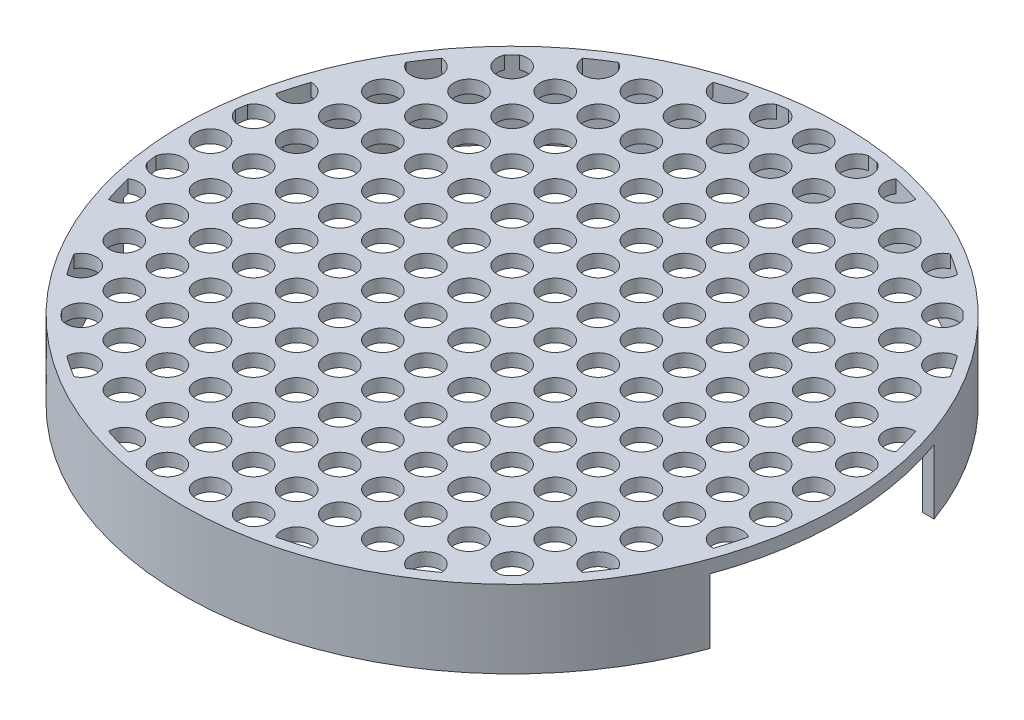
from build123d import *

# Parameters (mm, degrees)
BOSS_EXTRUDE1_DEPTH       = 15
BOSS_EXTRUDE1_2_DEPTH     = 15
BOSS_EXTRUDE2_OUTLINE_R   = 76.5
BOSS_EXTRUDE2_OUTLINE_R_2 = 3.5
BOSS_EXTRUDE2_DEPTH       = 3


with BuildPart() as part:
    # Sketch1 → Boss-Extrude1 (new body)
    with BuildSketch(Plane(origin=(0, 0, 0), x_dir=(1, 0, 0), z_dir=(0, 1, 0))):
        with BuildLine():
            Line((69.282032303, -26), (71.946160426, -26))
            ThreePointArc((71.946160426, -26), (-3.919919174, -76.399504145), (-74.22937424, -18.5))
            Line((-74.22937424, -18.5), (-71.650191905, -18.5))
            ThreePointArc((-71.650191905, -18.5), (-3.932498566, -73.895435955), (69.282032303, -26))
        make_face()
    extrude(amount=BOSS_EXTRUDE1_DEPTH)



with BuildPart() as body_2:
    # Sketch1 → Boss-Extrude1 2 (new body)
    with BuildSketch(Plane(origin=(0, 0, 0), x_dir=(1, 0, 0), z_dir=(0, 1, 0))):
        with BuildLine():
            Line((69.282032303, 26), (71.946160426, 26))
            ThreePointArc((71.946160426, 26), (-3.919919174, 76.399504145), (-74.22937424, 18.5))
            Line((-74.22937424, 18.5), (-71.650191905, 18.5))
            ThreePointArc((-71.650191905, 18.5), (-3.932498566, 73.895435955), (69.282032303, 26))
        make_face()
    extrude(amount=BOSS_EXTRUDE1_2_DEPTH)


with BuildPart() as part_1:
    add(part.part)

    add(body_2.part)  # Boss-Extrude2 merges body 2
    # Boss-Extrude2: read off the stored shape, not the designer's step
    # Boss-Extrude2 outline → Boss-Extrude2 (add)
    with BuildSketch(Plane(origin=(0, 15, 0), x_dir=(1, 0, 0), z_dir=(0, 1, 0))):
        Circle(BOSS_EXTRUDE2_OUTLINE_R)
        with BuildLine():
            ThreePointArc((-43.497444891, -59.866286739), (-38.058549313, -57.08782397), (-38.531401263, -63.176982491))
            ThreePointArc((-38.531401263, -63.176982491), (-41.047814521, -61.571721781), (-43.497444891, -59.866286739))
        make_face(mode=Mode.SUBTRACT)
        with BuildLine():
            ThreePointArc((-63.176982491, -38.531401263), (-57.08782397, -38.058549313), (-59.866286739, -43.497444891))
            ThreePointArc((-59.866286739, -43.497444891), (-61.571721781, -41.047814521), (-63.176982491, -38.531401263))
        make_face(mode=Mode.SUBTRACT)
        with BuildLine():
            ThreePointArc((-53.183850247, -51.453649753), (-47.525126266, -47.525126266), (-51.453649753, -53.183850247))
            ThreePointArc((-51.453649753, -53.183850247), (-52.325901808, -52.325901808), (-53.183850247, -51.453649753))
        make_face(mode=Mode.SUBTRACT)
        with Locations((-40, -50)):
            Circle(BOSS_EXTRUDE2_OUTLINE_R_2, mode=Mode.SUBTRACT)
        with Locations((-50, -40)):
            Circle(BOSS_EXTRUDE2_OUTLINE_R_2, mode=Mode.SUBTRACT)
        with Locations((-40, -40)):
            Circle(BOSS_EXTRUDE2_OUTLINE_R_2, mode=Mode.SUBTRACT)
        with BuildLine():
            ThreePointArc((-23.495828297, -70.170834772), (-19.038476052, -66.634666183), (-17.122096232, -71.991901077))
            ThreePointArc((-17.122096232, -71.991901077), (-20.329363465, -71.152772126), (-23.495828297, -70.170834772))
        make_face(mode=Mode.SUBTRACT)
        with Locations((-30, -60)):
            Circle(BOSS_EXTRUDE2_OUTLINE_R_2, mode=Mode.SUBTRACT)
        with Locations((-20, -60)):
            Circle(BOSS_EXTRUDE2_OUTLINE_R_2, mode=Mode.SUBTRACT)
        with BuildLine():
            ThreePointArc((-11.674890346, -73.073229951), (-9.505025255, -66.535176772), (-9.252609654, -73.419270049))
            ThreePointArc((-9.252609654, -73.419270049), (-10.465180362, -73.256262531), (-11.674890346, -73.073229951))
        make_face(mode=Mode.SUBTRACT)
        with Locations((-10, -60)):
            Circle(BOSS_EXTRUDE2_OUTLINE_R_2, mode=Mode.SUBTRACT)
        with Locations((-30, -50)):
            Circle(BOSS_EXTRUDE2_OUTLINE_R_2, mode=Mode.SUBTRACT)
        with Locations((-20, -50)):
            Circle(BOSS_EXTRUDE2_OUTLINE_R_2, mode=Mode.SUBTRACT)
        with Locations((-30, -40)):
            Circle(BOSS_EXTRUDE2_OUTLINE_R_2, mode=Mode.SUBTRACT)
        with Locations((-20, -40)):
            Circle(BOSS_EXTRUDE2_OUTLINE_R_2, mode=Mode.SUBTRACT)
        with Locations((-10, -50)):
            Circle(BOSS_EXTRUDE2_OUTLINE_R_2, mode=Mode.SUBTRACT)
        with Locations((-10, -40)):
            Circle(BOSS_EXTRUDE2_OUTLINE_R_2, mode=Mode.SUBTRACT)
        with Locations((-60, -30)):
            Circle(BOSS_EXTRUDE2_OUTLINE_R_2, mode=Mode.SUBTRACT)
        with BuildLine():
            ThreePointArc((-71.991901077, -17.122096232), (-66.634666183, -19.038476052), (-70.170834772, -23.495828297))
            ThreePointArc((-70.170834772, -23.495828297), (-71.152772126, -20.329363465), (-71.991901077, -17.122096232))
        make_face(mode=Mode.SUBTRACT)
        with Locations((-60, -20)):
            Circle(BOSS_EXTRUDE2_OUTLINE_R_2, mode=Mode.SUBTRACT)
        with Locations((-50, -30)):
            Circle(BOSS_EXTRUDE2_OUTLINE_R_2, mode=Mode.SUBTRACT)
        with Locations((-40, -30)):
            Circle(BOSS_EXTRUDE2_OUTLINE_R_2, mode=Mode.SUBTRACT)
        with Locations((-50, -20)):
            Circle(BOSS_EXTRUDE2_OUTLINE_R_2, mode=Mode.SUBTRACT)
        with Locations((-40, -20)):
            Circle(BOSS_EXTRUDE2_OUTLINE_R_2, mode=Mode.SUBTRACT)
        with BuildLine():
            ThreePointArc((-73.419270049, -9.252609654), (-66.535176772, -9.505025255), (-73.073229951, -11.674890346))
            ThreePointArc((-73.073229951, -11.674890346), (-73.256262531, -10.465180362), (-73.419270049, -9.252609654))
        make_face(mode=Mode.SUBTRACT)
        with Locations((-60, -10)):
            Circle(BOSS_EXTRUDE2_OUTLINE_R_2, mode=Mode.SUBTRACT)
        with Locations((-50, -10)):
            Circle(BOSS_EXTRUDE2_OUTLINE_R_2, mode=Mode.SUBTRACT)
        with Locations((-40, -10)):
            Circle(BOSS_EXTRUDE2_OUTLINE_R_2, mode=Mode.SUBTRACT)
        with Locations((-30, -30)):
            Circle(BOSS_EXTRUDE2_OUTLINE_R_2, mode=Mode.SUBTRACT)
        with Locations((-20, -30)):
            Circle(BOSS_EXTRUDE2_OUTLINE_R_2, mode=Mode.SUBTRACT)
        with Locations((-30, -20)):
            Circle(BOSS_EXTRUDE2_OUTLINE_R_2, mode=Mode.SUBTRACT)
        with Locations((-20, -20)):
            Circle(BOSS_EXTRUDE2_OUTLINE_R_2, mode=Mode.SUBTRACT)
        with Locations((-10, -30)):
            Circle(BOSS_EXTRUDE2_OUTLINE_R_2, mode=Mode.SUBTRACT)
        with Locations((-10, -20)):
            Circle(BOSS_EXTRUDE2_OUTLINE_R_2, mode=Mode.SUBTRACT)
        with Locations((-30, -10)):
            Circle(BOSS_EXTRUDE2_OUTLINE_R_2, mode=Mode.SUBTRACT)
        with Locations((-20, -10)):
            Circle(BOSS_EXTRUDE2_OUTLINE_R_2, mode=Mode.SUBTRACT)
        with Locations((-10, -10)):
            Circle(BOSS_EXTRUDE2_OUTLINE_R_2, mode=Mode.SUBTRACT)
        with Locations((0, -70)):
            Circle(BOSS_EXTRUDE2_OUTLINE_R_2, mode=Mode.SUBTRACT)
        with BuildLine():
            ThreePointArc((9.252609654, -73.419270049), (9.505025255, -66.535176772), (11.674890346, -73.073229951))
            ThreePointArc((11.674890346, -73.073229951), (10.465180362, -73.256262531), (9.252609654, -73.419270049))
        make_face(mode=Mode.SUBTRACT)
        with Locations((0, -60)):
            Circle(BOSS_EXTRUDE2_OUTLINE_R_2, mode=Mode.SUBTRACT)
        with Locations((10, -60)):
            Circle(BOSS_EXTRUDE2_OUTLINE_R_2, mode=Mode.SUBTRACT)
        with BuildLine():
            ThreePointArc((17.122096232, -71.991901077), (19.038476052, -66.634666183), (23.495828297, -70.170834772))
            ThreePointArc((23.495828297, -70.170834772), (20.329363465, -71.152772126), (17.122096232, -71.991901077))
        make_face(mode=Mode.SUBTRACT)
        with Locations((20, -60)):
            Circle(BOSS_EXTRUDE2_OUTLINE_R_2, mode=Mode.SUBTRACT)
        with Locations((30, -60)):
            Circle(BOSS_EXTRUDE2_OUTLINE_R_2, mode=Mode.SUBTRACT)
        with Locations((0, -50)):
            Circle(BOSS_EXTRUDE2_OUTLINE_R_2, mode=Mode.SUBTRACT)
        with Locations((10, -50)):
            Circle(BOSS_EXTRUDE2_OUTLINE_R_2, mode=Mode.SUBTRACT)
        with Locations((0, -40)):
            Circle(BOSS_EXTRUDE2_OUTLINE_R_2, mode=Mode.SUBTRACT)
        with Locations((10, -40)):
            Circle(BOSS_EXTRUDE2_OUTLINE_R_2, mode=Mode.SUBTRACT)
        with Locations((20, -50)):
            Circle(BOSS_EXTRUDE2_OUTLINE_R_2, mode=Mode.SUBTRACT)
        with Locations((30, -50)):
            Circle(BOSS_EXTRUDE2_OUTLINE_R_2, mode=Mode.SUBTRACT)
        with Locations((20, -40)):
            Circle(BOSS_EXTRUDE2_OUTLINE_R_2, mode=Mode.SUBTRACT)
        with Locations((30, -40)):
            Circle(BOSS_EXTRUDE2_OUTLINE_R_2, mode=Mode.SUBTRACT)
        with BuildLine():
            ThreePointArc((38.531401263, -63.176982491), (38.058549313, -57.08782397), (43.497444891, -59.866286739))
            ThreePointArc((43.497444891, -59.866286739), (41.047814521, -61.571721781), (38.531401263, -63.176982491))
        make_face(mode=Mode.SUBTRACT)
        with Locations((40, -50)):
            Circle(BOSS_EXTRUDE2_OUTLINE_R_2, mode=Mode.SUBTRACT)
        with BuildLine():
            ThreePointArc((51.453649753, -53.183850247), (47.525126266, -47.525126266), (53.183850247, -51.453649753))
            ThreePointArc((53.183850247, -51.453649753), (52.325901808, -52.325901808), (51.453649753, -53.183850247))
        make_face(mode=Mode.SUBTRACT)
        with Locations((40, -40)):
            Circle(BOSS_EXTRUDE2_OUTLINE_R_2, mode=Mode.SUBTRACT)
        with Locations((50, -40)):
            Circle(BOSS_EXTRUDE2_OUTLINE_R_2, mode=Mode.SUBTRACT)
        with BuildLine():
            ThreePointArc((59.866286739, -43.497444891), (57.08782397, -38.058549313), (63.176982491, -38.531401263))
            ThreePointArc((63.176982491, -38.531401263), (61.571721781, -41.047814521), (59.866286739, -43.497444891))
        make_face(mode=Mode.SUBTRACT)
        with Locations((0, -30)):
            Circle(BOSS_EXTRUDE2_OUTLINE_R_2, mode=Mode.SUBTRACT)
        with Locations((10, -30)):
            Circle(BOSS_EXTRUDE2_OUTLINE_R_2, mode=Mode.SUBTRACT)
        with Locations((0, -20)):
            Circle(BOSS_EXTRUDE2_OUTLINE_R_2, mode=Mode.SUBTRACT)
        with Locations((10, -20)):
            Circle(BOSS_EXTRUDE2_OUTLINE_R_2, mode=Mode.SUBTRACT)
        with Locations((20, -30)):
            Circle(BOSS_EXTRUDE2_OUTLINE_R_2, mode=Mode.SUBTRACT)
        with Locations((30, -30)):
            Circle(BOSS_EXTRUDE2_OUTLINE_R_2, mode=Mode.SUBTRACT)
        with Locations((20, -20)):
            Circle(BOSS_EXTRUDE2_OUTLINE_R_2, mode=Mode.SUBTRACT)
        with Locations((30, -20)):
            Circle(BOSS_EXTRUDE2_OUTLINE_R_2, mode=Mode.SUBTRACT)
        with Locations((0, -10)):
            Circle(BOSS_EXTRUDE2_OUTLINE_R_2, mode=Mode.SUBTRACT)
        with Locations((10, -10)):
            Circle(BOSS_EXTRUDE2_OUTLINE_R_2, mode=Mode.SUBTRACT)
        with Locations((20, -10)):
            Circle(BOSS_EXTRUDE2_OUTLINE_R_2, mode=Mode.SUBTRACT)
        with Locations((30, -10)):
            Circle(BOSS_EXTRUDE2_OUTLINE_R_2, mode=Mode.SUBTRACT)
        with Locations((40, -30)):
            Circle(BOSS_EXTRUDE2_OUTLINE_R_2, mode=Mode.SUBTRACT)
        with Locations((50, -30)):
            Circle(BOSS_EXTRUDE2_OUTLINE_R_2, mode=Mode.SUBTRACT)
        with Locations((40, -20)):
            Circle(BOSS_EXTRUDE2_OUTLINE_R_2, mode=Mode.SUBTRACT)
        with Locations((50, -20)):
            Circle(BOSS_EXTRUDE2_OUTLINE_R_2, mode=Mode.SUBTRACT)
        with Locations((60, -30)):
            Circle(BOSS_EXTRUDE2_OUTLINE_R_2, mode=Mode.SUBTRACT)
        with Locations((60, -20)):
            Circle(BOSS_EXTRUDE2_OUTLINE_R_2, mode=Mode.SUBTRACT)
        with BuildLine():
            ThreePointArc((70.170834772, -23.495828297), (66.634666183, -19.038476052), (71.991901077, -17.122096232))
            ThreePointArc((71.991901077, -17.122096232), (71.152772125, -20.329363465), (70.170834772, -23.495828297))
        make_face(mode=Mode.SUBTRACT)
        with Locations((40, -10)):
            Circle(BOSS_EXTRUDE2_OUTLINE_R_2, mode=Mode.SUBTRACT)
        with Locations((50, -10)):
            Circle(BOSS_EXTRUDE2_OUTLINE_R_2, mode=Mode.SUBTRACT)
        with Locations((60, -10)):
            Circle(BOSS_EXTRUDE2_OUTLINE_R_2, mode=Mode.SUBTRACT)
        with BuildLine():
            ThreePointArc((73.073229951, -11.674890346), (66.535176772, -9.505025255), (73.419270049, -9.252609654))
            ThreePointArc((73.419270049, -9.252609654), (73.256262531, -10.465180362), (73.073229951, -11.674890346))
        make_face(mode=Mode.SUBTRACT)
        with Locations((-70, 0)):
            Circle(BOSS_EXTRUDE2_OUTLINE_R_2, mode=Mode.SUBTRACT)
        with Locations((-60, 0)):
            Circle(BOSS_EXTRUDE2_OUTLINE_R_2, mode=Mode.SUBTRACT)
        with BuildLine():
            ThreePointArc((-73.073229951, 11.674890346), (-66.535176772, 9.505025255), (-73.419270049, 9.252609654))
            ThreePointArc((-73.419270049, 9.252609654), (-73.256262531, 10.465180362), (-73.073229951, 11.674890346))
        make_face(mode=Mode.SUBTRACT)
        with Locations((-60, 10)):
            Circle(BOSS_EXTRUDE2_OUTLINE_R_2, mode=Mode.SUBTRACT)
        with Locations((-50, 0)):
            Circle(BOSS_EXTRUDE2_OUTLINE_R_2, mode=Mode.SUBTRACT)
        with Locations((-40, 0)):
            Circle(BOSS_EXTRUDE2_OUTLINE_R_2, mode=Mode.SUBTRACT)
        with Locations((-50, 10)):
            Circle(BOSS_EXTRUDE2_OUTLINE_R_2, mode=Mode.SUBTRACT)
        with Locations((-40, 10)):
            Circle(BOSS_EXTRUDE2_OUTLINE_R_2, mode=Mode.SUBTRACT)
        with BuildLine():
            ThreePointArc((-70.170834772, 23.495828297), (-66.634666183, 19.038476052), (-71.991901077, 17.122096232))
            ThreePointArc((-71.991901077, 17.122096232), (-71.152772126, 20.329363465), (-70.170834772, 23.495828297))
        make_face(mode=Mode.SUBTRACT)
        with Locations((-60, 20)):
            Circle(BOSS_EXTRUDE2_OUTLINE_R_2, mode=Mode.SUBTRACT)
        with Locations((-60, 30)):
            Circle(BOSS_EXTRUDE2_OUTLINE_R_2, mode=Mode.SUBTRACT)
        with Locations((-50, 20)):
            Circle(BOSS_EXTRUDE2_OUTLINE_R_2, mode=Mode.SUBTRACT)
        with Locations((-40, 20)):
            Circle(BOSS_EXTRUDE2_OUTLINE_R_2, mode=Mode.SUBTRACT)
        with Locations((-50, 30)):
            Circle(BOSS_EXTRUDE2_OUTLINE_R_2, mode=Mode.SUBTRACT)
        with Locations((-40, 30)):
            Circle(BOSS_EXTRUDE2_OUTLINE_R_2, mode=Mode.SUBTRACT)
        with Locations((-30, 0)):
            Circle(BOSS_EXTRUDE2_OUTLINE_R_2, mode=Mode.SUBTRACT)
        with Locations((-20, 0)):
            Circle(BOSS_EXTRUDE2_OUTLINE_R_2, mode=Mode.SUBTRACT)
        with Locations((-30, 10)):
            Circle(BOSS_EXTRUDE2_OUTLINE_R_2, mode=Mode.SUBTRACT)
        with Locations((-20, 10)):
            Circle(BOSS_EXTRUDE2_OUTLINE_R_2, mode=Mode.SUBTRACT)
        with Locations((-10, 0)):
            Circle(BOSS_EXTRUDE2_OUTLINE_R_2, mode=Mode.SUBTRACT)
        with Locations((-10, 10)):
            Circle(BOSS_EXTRUDE2_OUTLINE_R_2, mode=Mode.SUBTRACT)
        with Locations((-30, 20)):
            Circle(BOSS_EXTRUDE2_OUTLINE_R_2, mode=Mode.SUBTRACT)
        with Locations((-20, 20)):
            Circle(BOSS_EXTRUDE2_OUTLINE_R_2, mode=Mode.SUBTRACT)
        with Locations((-30, 30)):
            Circle(BOSS_EXTRUDE2_OUTLINE_R_2, mode=Mode.SUBTRACT)
        with Locations((-20, 30)):
            Circle(BOSS_EXTRUDE2_OUTLINE_R_2, mode=Mode.SUBTRACT)
        with Locations((-10, 20)):
            Circle(BOSS_EXTRUDE2_OUTLINE_R_2, mode=Mode.SUBTRACT)
        with Locations((-10, 30)):
            Circle(BOSS_EXTRUDE2_OUTLINE_R_2, mode=Mode.SUBTRACT)
        with BuildLine():
            ThreePointArc((-59.866286739, 43.497444891), (-57.08782397, 38.058549313), (-63.176982491, 38.531401263))
            ThreePointArc((-63.176982491, 38.531401263), (-61.571721781, 41.047814521), (-59.866286739, 43.497444891))
        make_face(mode=Mode.SUBTRACT)
        with Locations((-50, 40)):
            Circle(BOSS_EXTRUDE2_OUTLINE_R_2, mode=Mode.SUBTRACT)
        with Locations((-40, 40)):
            Circle(BOSS_EXTRUDE2_OUTLINE_R_2, mode=Mode.SUBTRACT)
        with BuildLine():
            ThreePointArc((-51.453649753, 53.183850247), (-47.525126266, 47.525126266), (-53.183850247, 51.453649753))
            ThreePointArc((-53.183850247, 51.453649753), (-52.325901808, 52.325901808), (-51.453649753, 53.183850247))
        make_face(mode=Mode.SUBTRACT)
        with Locations((-40, 50)):
            Circle(BOSS_EXTRUDE2_OUTLINE_R_2, mode=Mode.SUBTRACT)
        with BuildLine():
            ThreePointArc((-38.531401263, 63.176982491), (-38.058549313, 57.08782397), (-43.497444891, 59.866286739))
            ThreePointArc((-43.497444891, 59.866286739), (-41.047814521, 61.571721781), (-38.531401263, 63.176982491))
        make_face(mode=Mode.SUBTRACT)
        with Locations((-30, 40)):
            Circle(BOSS_EXTRUDE2_OUTLINE_R_2, mode=Mode.SUBTRACT)
        with Locations((-20, 40)):
            Circle(BOSS_EXTRUDE2_OUTLINE_R_2, mode=Mode.SUBTRACT)
        with Locations((-30, 50)):
            Circle(BOSS_EXTRUDE2_OUTLINE_R_2, mode=Mode.SUBTRACT)
        with Locations((-20, 50)):
            Circle(BOSS_EXTRUDE2_OUTLINE_R_2, mode=Mode.SUBTRACT)
        with Locations((-10, 40)):
            Circle(BOSS_EXTRUDE2_OUTLINE_R_2, mode=Mode.SUBTRACT)
        with Locations((-10, 50)):
            Circle(BOSS_EXTRUDE2_OUTLINE_R_2, mode=Mode.SUBTRACT)
        with Locations((-30, 60)):
            Circle(BOSS_EXTRUDE2_OUTLINE_R_2, mode=Mode.SUBTRACT)
        with Locations((-20, 60)):
            Circle(BOSS_EXTRUDE2_OUTLINE_R_2, mode=Mode.SUBTRACT)
        with BuildLine():
            ThreePointArc((-17.122096232, 71.991901077), (-19.038476052, 66.634666183), (-23.495828297, 70.170834772))
            ThreePointArc((-23.495828297, 70.170834772), (-20.329363465, 71.152772126), (-17.122096232, 71.991901077))
        make_face(mode=Mode.SUBTRACT)
        with Locations((-10, 60)):
            Circle(BOSS_EXTRUDE2_OUTLINE_R_2, mode=Mode.SUBTRACT)
        with BuildLine():
            ThreePointArc((-9.252609654, 73.419270049), (-9.505025255, 66.535176772), (-11.674890346, 73.073229951))
            ThreePointArc((-11.674890346, 73.073229951), (-10.465180362, 73.256262531), (-9.252609654, 73.419270049))
        make_face(mode=Mode.SUBTRACT)
        Circle(BOSS_EXTRUDE2_OUTLINE_R_2, mode=Mode.SUBTRACT)
        with Locations((10, 0)):
            Circle(BOSS_EXTRUDE2_OUTLINE_R_2, mode=Mode.SUBTRACT)
        with Locations((0, 10)):
            Circle(BOSS_EXTRUDE2_OUTLINE_R_2, mode=Mode.SUBTRACT)
        with Locations((10, 10)):
            Circle(BOSS_EXTRUDE2_OUTLINE_R_2, mode=Mode.SUBTRACT)
        with Locations((20, 0)):
            Circle(BOSS_EXTRUDE2_OUTLINE_R_2, mode=Mode.SUBTRACT)
        with Locations((30, 0)):
            Circle(BOSS_EXTRUDE2_OUTLINE_R_2, mode=Mode.SUBTRACT)
        with Locations((20, 10)):
            Circle(BOSS_EXTRUDE2_OUTLINE_R_2, mode=Mode.SUBTRACT)
        with Locations((30, 10)):
            Circle(BOSS_EXTRUDE2_OUTLINE_R_2, mode=Mode.SUBTRACT)
        with Locations((0, 20)):
            Circle(BOSS_EXTRUDE2_OUTLINE_R_2, mode=Mode.SUBTRACT)
        with Locations((10, 20)):
            Circle(BOSS_EXTRUDE2_OUTLINE_R_2, mode=Mode.SUBTRACT)
        with Locations((0, 30)):
            Circle(BOSS_EXTRUDE2_OUTLINE_R_2, mode=Mode.SUBTRACT)
        with Locations((10, 30)):
            Circle(BOSS_EXTRUDE2_OUTLINE_R_2, mode=Mode.SUBTRACT)
        with Locations((20, 20)):
            Circle(BOSS_EXTRUDE2_OUTLINE_R_2, mode=Mode.SUBTRACT)
        with Locations((30, 20)):
            Circle(BOSS_EXTRUDE2_OUTLINE_R_2, mode=Mode.SUBTRACT)
        with Locations((20, 30)):
            Circle(BOSS_EXTRUDE2_OUTLINE_R_2, mode=Mode.SUBTRACT)
        with Locations((30, 30)):
            Circle(BOSS_EXTRUDE2_OUTLINE_R_2, mode=Mode.SUBTRACT)
        with Locations((40, 0)):
            Circle(BOSS_EXTRUDE2_OUTLINE_R_2, mode=Mode.SUBTRACT)
        with Locations((50, 0)):
            Circle(BOSS_EXTRUDE2_OUTLINE_R_2, mode=Mode.SUBTRACT)
        with Locations((40, 10)):
            Circle(BOSS_EXTRUDE2_OUTLINE_R_2, mode=Mode.SUBTRACT)
        with Locations((50, 10)):
            Circle(BOSS_EXTRUDE2_OUTLINE_R_2, mode=Mode.SUBTRACT)
        with Locations((60, 0)):
            Circle(BOSS_EXTRUDE2_OUTLINE_R_2, mode=Mode.SUBTRACT)
        with Locations((70, 0)):
            Circle(BOSS_EXTRUDE2_OUTLINE_R_2, mode=Mode.SUBTRACT)
        with Locations((60, 10)):
            Circle(BOSS_EXTRUDE2_OUTLINE_R_2, mode=Mode.SUBTRACT)
        with BuildLine():
            ThreePointArc((73.419270049, 9.252609654), (66.535176772, 9.505025255), (73.073229951, 11.674890346))
            ThreePointArc((73.073229951, 11.674890346), (73.256262531, 10.465180362), (73.419270049, 9.252609654))
        make_face(mode=Mode.SUBTRACT)
        with Locations((40, 20)):
            Circle(BOSS_EXTRUDE2_OUTLINE_R_2, mode=Mode.SUBTRACT)
        with Locations((50, 20)):
            Circle(BOSS_EXTRUDE2_OUTLINE_R_2, mode=Mode.SUBTRACT)
        with Locations((40, 30)):
            Circle(BOSS_EXTRUDE2_OUTLINE_R_2, mode=Mode.SUBTRACT)
        with Locations((50, 30)):
            Circle(BOSS_EXTRUDE2_OUTLINE_R_2, mode=Mode.SUBTRACT)
        with Locations((60, 20)):
            Circle(BOSS_EXTRUDE2_OUTLINE_R_2, mode=Mode.SUBTRACT)
        with BuildLine():
            ThreePointArc((71.991901077, 17.122096232), (66.634666183, 19.038476052), (70.170834772, 23.495828297))
            ThreePointArc((70.170834772, 23.495828297), (71.152772125, 20.329363465), (71.991901077, 17.122096232))
        make_face(mode=Mode.SUBTRACT)
        with Locations((60, 30)):
            Circle(BOSS_EXTRUDE2_OUTLINE_R_2, mode=Mode.SUBTRACT)
        with Locations((0, 40)):
            Circle(BOSS_EXTRUDE2_OUTLINE_R_2, mode=Mode.SUBTRACT)
        with Locations((10, 40)):
            Circle(BOSS_EXTRUDE2_OUTLINE_R_2, mode=Mode.SUBTRACT)
        with Locations((0, 50)):
            Circle(BOSS_EXTRUDE2_OUTLINE_R_2, mode=Mode.SUBTRACT)
        with Locations((10, 50)):
            Circle(BOSS_EXTRUDE2_OUTLINE_R_2, mode=Mode.SUBTRACT)
        with Locations((20, 40)):
            Circle(BOSS_EXTRUDE2_OUTLINE_R_2, mode=Mode.SUBTRACT)
        with Locations((30, 40)):
            Circle(BOSS_EXTRUDE2_OUTLINE_R_2, mode=Mode.SUBTRACT)
        with Locations((20, 50)):
            Circle(BOSS_EXTRUDE2_OUTLINE_R_2, mode=Mode.SUBTRACT)
        with Locations((30, 50)):
            Circle(BOSS_EXTRUDE2_OUTLINE_R_2, mode=Mode.SUBTRACT)
        with Locations((0, 60)):
            Circle(BOSS_EXTRUDE2_OUTLINE_R_2, mode=Mode.SUBTRACT)
        with Locations((10, 60)):
            Circle(BOSS_EXTRUDE2_OUTLINE_R_2, mode=Mode.SUBTRACT)
        with Locations((0, 70)):
            Circle(BOSS_EXTRUDE2_OUTLINE_R_2, mode=Mode.SUBTRACT)
        with BuildLine():
            ThreePointArc((11.674890346, 73.073229951), (9.505025255, 66.535176772), (9.252609654, 73.419270049))
            ThreePointArc((9.252609654, 73.419270049), (10.465180362, 73.256262531), (11.674890346, 73.073229951))
        make_face(mode=Mode.SUBTRACT)
        with Locations((20, 60)):
            Circle(BOSS_EXTRUDE2_OUTLINE_R_2, mode=Mode.SUBTRACT)
        with Locations((30, 60)):
            Circle(BOSS_EXTRUDE2_OUTLINE_R_2, mode=Mode.SUBTRACT)
        with BuildLine():
            ThreePointArc((23.495828297, 70.170834772), (19.038476052, 66.634666183), (17.122096232, 71.991901077))
            ThreePointArc((17.122096232, 71.991901077), (20.329363465, 71.152772126), (23.495828297, 70.170834772))
        make_face(mode=Mode.SUBTRACT)
        with Locations((40, 40)):
            Circle(BOSS_EXTRUDE2_OUTLINE_R_2, mode=Mode.SUBTRACT)
        with Locations((50, 40)):
            Circle(BOSS_EXTRUDE2_OUTLINE_R_2, mode=Mode.SUBTRACT)
        with Locations((40, 50)):
            Circle(BOSS_EXTRUDE2_OUTLINE_R_2, mode=Mode.SUBTRACT)
        with BuildLine():
            ThreePointArc((53.183850247, 51.453649753), (47.525126266, 47.525126266), (51.453649753, 53.183850247))
            ThreePointArc((51.453649753, 53.183850247), (52.325901808, 52.325901808), (53.183850247, 51.453649753))
        make_face(mode=Mode.SUBTRACT)
        with BuildLine():
            ThreePointArc((63.176982491, 38.531401263), (57.08782397, 38.058549313), (59.866286739, 43.497444891))
            ThreePointArc((59.866286739, 43.497444891), (61.571721781, 41.047814521), (63.176982491, 38.531401263))
        make_face(mode=Mode.SUBTRACT)
        with BuildLine():
            ThreePointArc((43.497444891, 59.866286739), (38.058549313, 57.08782397), (38.531401263, 63.176982491))
            ThreePointArc((38.531401263, 63.176982491), (41.047814521, 61.571721781), (43.497444891, 59.866286739))
        make_face(mode=Mode.SUBTRACT)
    extrude(amount=BOSS_EXTRUDE2_DEPTH)


solid = part_1.part
